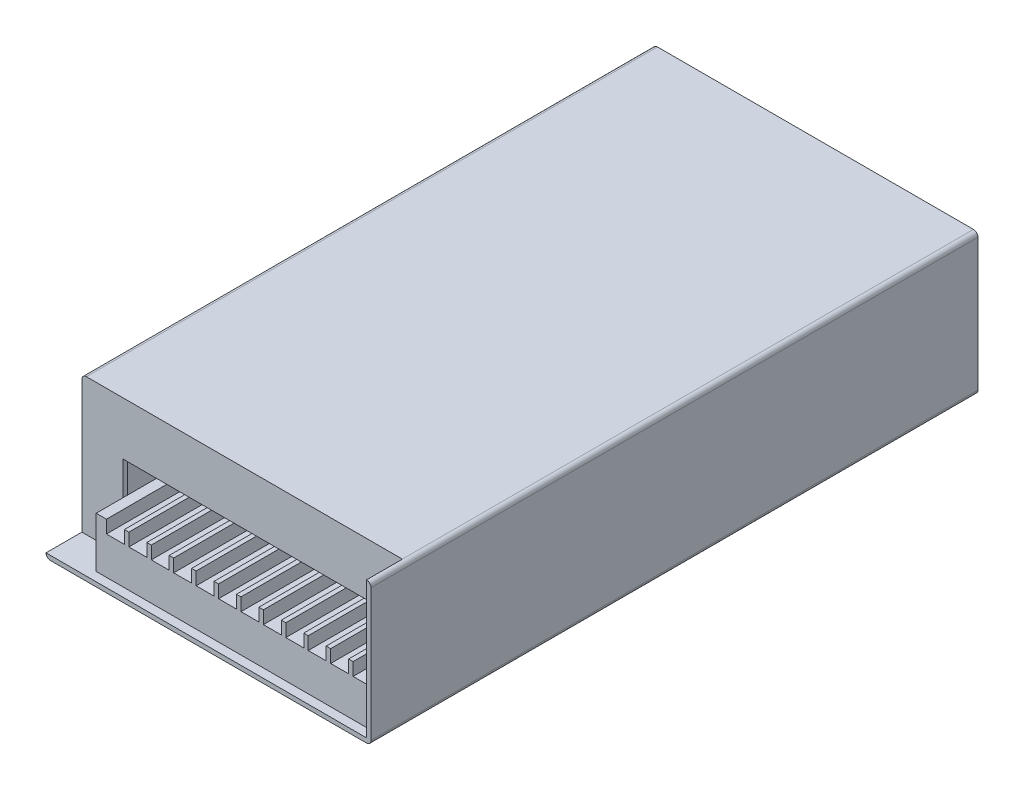
from build123d import *

# Parameters (mm, degrees)
SKETCH1_W           = 115.062
SKETCH1_H           = 214.884
BOSS_EXTRUDE1_DEPTH = 50.038
SKETCH2_W           = 113.4745
SKETCH2_H           = 12.7
CUT_EXTRUDE1_DEPTH  = 48.4505
FILLET2_R           = 1.5875
SHELL2_START        = 1.5875
SHELL2_OUTLINE_W    = 111.887
SHELL2_OUTLINE_H    = 199.009
SHELL2_DEPTH        = 46.863
SHELL2_2_OUTLINE_W  = 98.886987896
SHELL2_2_OUTLINE_H  = 1.5875
SHELL2_2_DEPTH      = 29.689064402
SKETCH3_W           = 98.886987896
SKETCH3_H           = 64.932506417
BOSS_EXTRUDE2_DEPTH = 17.8435
CUT_EXTRUDE2_REACH  = 227.021
SKETCH5_W           = 6.35
SKETCH5_H           = 4.550671723
LPATTERN1_COUNT     = 12
LPATTERN1_PITCH     = 7.9375


# Read off the part's stored shape, not the designer's step: Shell2
with BuildPart() as part:
    # Sketch1 → Boss-Extrude1 (new body)
    with BuildSketch(Plane(origin=(0, 0, 0), x_dir=(1, 0, 0), z_dir=(0, 1, 0))):
        Rectangle(SKETCH1_W, SKETCH1_H)
    extrude(amount=BOSS_EXTRUDE1_DEPTH)

    # Sketch2 → Cut-Extrude1 (cut)
    with BuildSketch(Plane(origin=(0, 50.038, 0), x_dir=(1, 0, 0), z_dir=(0, 1, 0))):
        with Locations((-0.79375, -101.092)):
            Rectangle(SKETCH2_W, SKETCH2_H)
    extrude(amount=-CUT_EXTRUDE1_DEPTH, mode=Mode.SUBTRACT)

    # Fillet2
    fillet2_edges = [part.edges().sort_by_distance(p)[0] for p in [
        (-57.531, 0, 0),
        (-57.531, 50.038, -6.35),
        (57.531, 0, 0),
        (57.531, 50.038, 0),
    ]]
    fillet(fillet2_edges, radius=FILLET2_R)

    # Shell2 outline → Shell2 (cut)
    with BuildSketch(Plane(origin=(0, 0, 0), x_dir=(1, 0, 0), z_dir=(0, 1, 0)).offset(SHELL2_START)):
        with Locations((0, 6.35)):
            Rectangle(SHELL2_OUTLINE_W, SHELL2_OUTLINE_H)
    extrude(amount=SHELL2_DEPTH, mode=Mode.SUBTRACT)

    # Shell2 2 outline → Shell2 2 (cut)
    with BuildSketch(Plane(origin=(0, 0, 0), x_dir=(1, 0, 0), z_dir=(0, 1, 0)).offset(SHELL2_START)):
        with Locations((6.500006052, -93.94825)):
            Rectangle(SHELL2_2_OUTLINE_W, SHELL2_2_OUTLINE_H)
    extrude(amount=SHELL2_2_DEPTH, mode=Mode.SUBTRACT)

    # Sketch3 → Boss-Extrude2 (add)
    with BuildSketch(Plane(origin=(0, 1.5875, 0), x_dir=(1, 0, 0), z_dir=(0, 1, 0))):
        with Locations((6.500006052, -71.800746792)):
            Rectangle(SKETCH3_W, SKETCH3_H)
    extrude(amount=BOSS_EXTRUDE2_DEPTH)

    # Sketch5 → Cut-Extrude2 (cut, up to next)
    with BuildSketch(Plane.XY.offset(104.267), mode=Mode.PRIVATE) as cut_extrude2_sk1:
        with Locations((51.181, 17.155664139)):
            Rectangle(SKETCH5_W, SKETCH5_H)
    cut_extrude2_tool1 = extrude(cut_extrude2_sk1.sketch, amount=-CUT_EXTRUDE2_REACH, mode=Mode.PRIVATE) & part.part
    cut_extrude2 = cut_extrude2_tool1.solids().sort_by_distance((51.181, 17.155664, 104.267))[0]
    add(cut_extrude2, mode=Mode.SUBTRACT)

    # LPattern1: Cut-Extrude2 ×12
    with Locations(*[(-i * LPATTERN1_PITCH, 0, 0) for i in range(1, LPATTERN1_COUNT)]):
        add(cut_extrude2, mode=Mode.SUBTRACT)


solid = part.part
